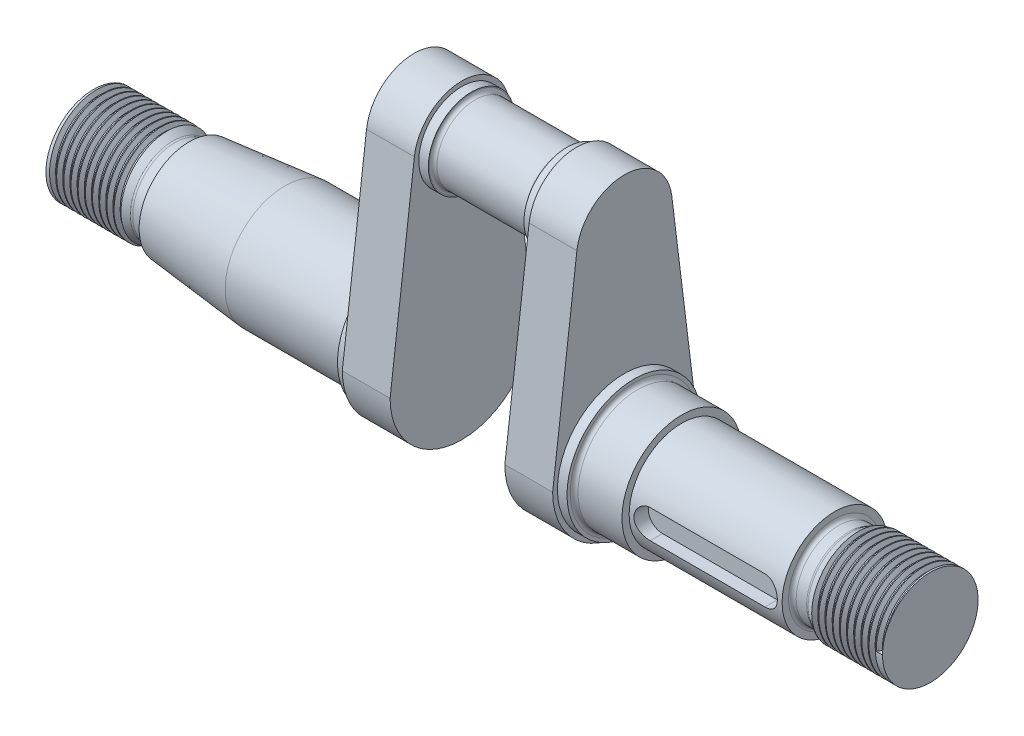
from build123d import *

# Parameters (mm, degrees)
Y_KSEKLIK_EKSTR_ZYON1_DEPTH = 15
KES_EKSTR_ZYON1_DEPTH       = 10
KES_EKSTR_ZYON2_DEPTH       = 3
DI_1_PITCH                  = 1.5
DI_2_PITCH                  = 1.5


with BuildPart() as part:
    # Çizim1 → Döndür3 (revolve)
    with BuildSketch(Plane.XY, mode=Mode.PRIVATE) as d_nd_r3_sk:
        with BuildLine():
            ThreePointArc((-2.8, 12.5), (-2.234314575, 12.734314575), (-2, 13.3))
            Line((-2, 13.3), (-2, 14))
            Line((-2, 14), (0, 14))
            Line((0, 14), (0, 0))
            Line((0, 0), (-67, 0))
            Line((-67, 0), (-67, 10))
            Line((-67, 10), (-52.2, 10))
            Line((-52.2, 10), (-50.393782217, 8.957179677))
            ThreePointArc((-50.393782217, 8.957179677), (-50.200837453, 8.877259339), (-49.993782217, 8.85))
            Line((-49.993782217, 8.85), (-47.8, 8.85))
            ThreePointArc((-47.8, 8.85), (-47.234314575, 9.084314575), (-47, 9.65))
            Line((-47, 9.65), (-47, 10.5))
            Line((-47, 10.5), (-27, 12.5))
            Line((-27, 12.5), (-2.8, 12.5))
        make_face()
    revolve(d_nd_r3_sk.sketch.rotate(Axis((127.616998905, 0, 0), (-1, 0, 0)), 90), axis=Axis((127.616998905, 0, 0), (-1, 0, 0)))

    # Çizim2 → Yükseklik-Ekstrüzyon1 (add, symmetric)
    with BuildSketch(Plane.XY):
        Polygon((0, 0), (0, 50), (10, 50), (10, -15), (0, -15), align=None)
    y_kseklik_ekstr_zyon1 = extrude(amount=Y_KSEKLIK_EKSTR_ZYON1_DEPTH, both=True)

    # Çizim3 → Kes-Ekstrüzyon1 (cut)
    with BuildSketch(Plane(origin=(10, 0, 0), x_dir=(0, 0, -1), z_dir=(1, 0, 0))):
        with BuildLine():
            Line((0, 50), (-15, 50))
            Line((-15, 50), (-15, 0))
            Line((-15, 0), (-9.925067247, 41.221900218))
            ThreePointArc((-9.925067247, 41.221900218), (-6.624990484, 47.49062755), (0, 50))
        make_face()
        with BuildLine():
            Line((15, 50), (0, 50))
            ThreePointArc((0, 50), (6.624990484, 47.49062755), (9.925067247, 41.221900218))
            Line((9.925067247, 41.221900218), (15, 0))
            Line((15, 0), (15, 50))
        make_face()
        with BuildLine():
            ThreePointArc((15, 0), (10.606601718, -10.606601718), (0, -15))
            Line((0, -15), (15, -15))
            Line((15, -15), (15, 0))
        make_face()
        with BuildLine():
            ThreePointArc((0, -15), (-10.606601718, -10.606601718), (-15, 0))
            Line((-15, 0), (-15, -15))
            Line((-15, -15), (0, -15))
        make_face()
    kes_ekstr_zyon1 = extrude(amount=-KES_EKSTR_ZYON1_DEPTH, mode=Mode.SUBTRACT)

    # Çizim6 → Döndür4 (revolve)
    with BuildSketch(Plane.XY, mode=Mode.PRIVATE) as d_nd_r4_sk:
        with BuildLine():
            Line((10, 40), (10, 49))
            Line((10, 49), (12, 49))
            Line((12, 49), (12, 48.8))
            ThreePointArc((12, 48.8), (12.234314575, 48.234314575), (12.8, 48))
            Line((12.8, 48), (31.2, 48))
            ThreePointArc((31.2, 48), (31.765685425, 48.234314575), (32, 48.8))
            Line((32, 48.8), (32, 49))
            Line((32, 49), (34, 49))
            Line((34, 49), (34, 40))
            Line((34, 40), (10, 40))
        make_face()
    revolve(d_nd_r4_sk.sketch.rotate(Axis((10, 40, 0), (1, 0, 0)), 90), axis=Axis((10, 40, 0), (1, 0, 0)))

    # Aynalama1: Yükseklik-Ekstrüzyon1 across plane
    add(y_kseklik_ekstr_zyon1.mirror(Plane(origin=(22, 0, 0), x_dir=(0, 0, 1), z_dir=(1, 0, 0))))

    # Aynalama2: Kes-Ekstrüzyon1 across plane
    add(kes_ekstr_zyon1.mirror(Plane(origin=(22, 0, 0), x_dir=(0, 0, 1), z_dir=(1, 0, 0))), mode=Mode.SUBTRACT)

    # Çizim9 → Döndür5 (revolve)
    with BuildSketch(Plane.XY, mode=Mode.PRIVATE) as d_nd_r5_sk:
        with BuildLine():
            Line((44, 0), (44, 14))
            Line((44, 14), (46, 14))
            Line((46, 14), (46, 13.3))
            ThreePointArc((46, 13.3), (46.234314575, 12.734314575), (46.8, 12.5))
            Line((46.8, 12.5), (56, 12.5))
            Line((56, 12.5), (56, 11))
            Line((56, 11), (88, 11))
            Line((88, 11), (88, 0))
            Line((88, 0), (44, 0))
        make_face()
    revolve(d_nd_r5_sk.sketch.rotate(Axis((44, 0, 0), (1, 0, 0)), 90), axis=Axis((44, 0, 0), (1, 0, 0)))

    # Çizim10 → Döndür6 (revolve)
    with BuildSketch(Plane.XY, mode=Mode.PRIVATE) as d_nd_r6_sk:
        with BuildLine():
            Line((88, 0), (108, 0))
            Line((108, 0), (108, 10))
            Line((108, 10), (93.2, 10))
            Line((93.2, 10), (91.393782217, 8.957179677))
            ThreePointArc((91.393782217, 8.957179677), (91.200837453, 8.877259339), (90.993782217, 8.85))
            Line((90.993782217, 8.85), (88.8, 8.85))
            ThreePointArc((88.8, 8.85), (88.234314575, 9.084314575), (88, 9.65))
            Line((88, 9.65), (88, 0))
        make_face()
    revolve(d_nd_r6_sk.sketch.rotate(Axis((44, 0, 0), (1, 0, 0)), 90), axis=Axis((44, 0, 0), (1, 0, 0)))

    # Çizim11 → Kes-Ekstrüzyon2 (cut)
    with BuildSketch(Plane.XY.offset(11)):
        with BuildLine():
            Line((84, -3), (60, -3))
            ThreePointArc((60, -3), (57, 0), (60, 3))
            Line((60, 3), (84, 3))
            ThreePointArc((84, 3), (87, 0), (84, -3))
        make_face()
    kes_ekstr_zyon2 = extrude(amount=-KES_EKSTR_ZYON2_DEPTH, mode=Mode.SUBTRACT)

    # Aynalama3: Kes-Ekstrüzyon2 across plane
    add(kes_ekstr_zyon2.mirror(Plane.XY), mode=Mode.SUBTRACT)

    # Diş1: the profile of Diş Profili1 profile screwed along a right-hand helix of 9.866667 turns, 8 arcs to a turn; built about Z, then put on its axis
    di_1_z = Axis((0, 0, 0), (0, 0, 1))
    di_1_corners = [(10.0003, 0, -0.000173205), (10.0003, 0, 1.312673201), (9.188101187, 0, 0.843749998), (9.188101187, 0, 0.468749998)]
    with BuildLine(mode=Mode.PRIVATE) as di_1_profile:
        Line(di_1_corners[0], di_1_corners[1])
        Line(di_1_corners[1], di_1_corners[2])
        Line(di_1_corners[2], di_1_corners[3])
        Line(di_1_corners[3], di_1_corners[0])
    di_1_cap = Face(di_1_profile.wire())
    di_1_turn_angles = [0, 22.5, 45, 67.5, 90, 112.5, 135, 157.5, 180, 202.5, 225, 247.5, 270, 292.5, 315, 337.5, 360]
    di_1_turn_weights = [1, 0.9238795325112867, 1, 0.9238795325112867, 1, 0.9238795325112867, 1, 0.9238795325112867, 1, 0.9238795325112867, 1, 0.9238795325112867, 1, 0.9238795325112867, 1, 0.9238795325112867, 1]
    di_1_turn_rails = [Edge.make_bspline([Vector(p[0], p[1], 0).rotate(di_1_z, di_1_turn_angles[k]) / di_1_turn_weights[k] + Vector(0, 0, p[2] + DI_1_PITCH * di_1_turn_angles[k] / 360) for k in range(17)], [0, 0, 0, 1, 1, 2, 2, 3, 3, 4, 4, 5, 5, 6, 6, 7, 7, 8, 8, 8], 2, di_1_turn_weights) for p in di_1_corners]
    di_1_turn_sides = [Face.make_surface_from_curves(di_1_turn_rails[p[0]], di_1_turn_rails[p[1]]) for p in [(0, 1), (1, 2), (2, 3), (3, 0)]]
    di_1_last_angles = [3240, 3262.5, 3285, 3307.5, 3330, 3352.5, 3375, 3397.5, 3420, 3442.5, 3465, 3487.5, 3510, 3531, 3552]
    di_1_last_weights = [1, 0.9238795325112867, 1, 0.9238795325112867, 1, 0.9238795325112867, 1, 0.9238795325112867, 1, 0.9238795325112867, 1, 0.9238795325112867, 1, 0.9335804264971975, 1]
    di_1_last_rails = [Edge.make_bspline([Vector(p[0], p[1], 0).rotate(di_1_z, di_1_last_angles[k]) / di_1_last_weights[k] + Vector(0, 0, p[2] + DI_1_PITCH * di_1_last_angles[k] / 360) for k in range(15)], [0, 0, 0, 1, 1, 2, 2, 3, 3, 4, 4, 5, 5, 6, 6, 7, 7, 7], 2, di_1_last_weights) for p in di_1_corners]
    di_1_last_sides = [Face.make_surface_from_curves(di_1_last_rails[p[0]], di_1_last_rails[p[1]]) for p in [(0, 1), (1, 2), (2, 3), (3, 0)]]
    di_1 = Plane(origin=(-67, 0, 0), x_dir=(0, 0, -1), z_dir=(1, 0, 0)) * Solid(Shell([*[p.moved(Location((0, 0, DI_1_PITCH * i))) for i in range(9) for p in di_1_turn_sides], *di_1_last_sides, di_1_cap, di_1_cap.rotate(di_1_z, 3552).moved(Location((0, 0, DI_1_PITCH * 3552 / 360)))]))
    add(di_1, mode=Mode.SUBTRACT)

    # Diş2: the profile of Diş Profili2 profile screwed along a right-hand helix of 9.866667 turns, 8 arcs to a turn; built about Z, then put on its axis
    di_2_z = Axis((0, 0, 0), (0, 0, 1))
    di_2_corners = [(10.0003, 0, -0.000173205), (10.0003, 0, 1.312673201), (9.188101187, 0, 0.843749998), (9.188101187, 0, 0.468749998)]
    with BuildLine(mode=Mode.PRIVATE) as di_2_profile:
        Line(di_2_corners[0], di_2_corners[1])
        Line(di_2_corners[1], di_2_corners[2])
        Line(di_2_corners[2], di_2_corners[3])
        Line(di_2_corners[3], di_2_corners[0])
    di_2_cap = Face(di_2_profile.wire())
    di_2_turn_angles = [0, 22.5, 45, 67.5, 90, 112.5, 135, 157.5, 180, 202.5, 225, 247.5, 270, 292.5, 315, 337.5, 360]
    di_2_turn_weights = [1, 0.9238795325112867, 1, 0.9238795325112867, 1, 0.9238795325112867, 1, 0.9238795325112867, 1, 0.9238795325112867, 1, 0.9238795325112867, 1, 0.9238795325112867, 1, 0.9238795325112867, 1]
    di_2_turn_rails = [Edge.make_bspline([Vector(p[0], p[1], 0).rotate(di_2_z, di_2_turn_angles[k]) / di_2_turn_weights[k] + Vector(0, 0, p[2] + DI_2_PITCH * di_2_turn_angles[k] / 360) for k in range(17)], [0, 0, 0, 1, 1, 2, 2, 3, 3, 4, 4, 5, 5, 6, 6, 7, 7, 8, 8, 8], 2, di_2_turn_weights) for p in di_2_corners]
    di_2_turn_sides = [Face.make_surface_from_curves(di_2_turn_rails[p[0]], di_2_turn_rails[p[1]]) for p in [(0, 1), (1, 2), (2, 3), (3, 0)]]
    di_2_last_angles = [3240, 3262.5, 3285, 3307.5, 3330, 3352.5, 3375, 3397.5, 3420, 3442.5, 3465, 3487.5, 3510, 3531, 3552]
    di_2_last_weights = [1, 0.9238795325112867, 1, 0.9238795325112867, 1, 0.9238795325112867, 1, 0.9238795325112867, 1, 0.9238795325112867, 1, 0.9238795325112867, 1, 0.9335804264972088, 1]
    di_2_last_rails = [Edge.make_bspline([Vector(p[0], p[1], 0).rotate(di_2_z, di_2_last_angles[k]) / di_2_last_weights[k] + Vector(0, 0, p[2] + DI_2_PITCH * di_2_last_angles[k] / 360) for k in range(15)], [0, 0, 0, 1, 1, 2, 2, 3, 3, 4, 4, 5, 5, 6, 6, 7, 7, 7], 2, di_2_last_weights) for p in di_2_corners]
    di_2_last_sides = [Face.make_surface_from_curves(di_2_last_rails[p[0]], di_2_last_rails[p[1]]) for p in [(0, 1), (1, 2), (2, 3), (3, 0)]]
    di_2 = Plane(origin=(108, 0, 0), x_dir=(0, 0, 1), z_dir=(-1, 0, 0)) * Solid(Shell([*[p.moved(Location((0, 0, DI_2_PITCH * i))) for i in range(9) for p in di_2_turn_sides], *di_2_last_sides, di_2_cap, di_2_cap.rotate(di_2_z, 3552).moved(Location((0, 0, DI_2_PITCH * 3552 / 360)))]))
    add(di_2, mode=Mode.SUBTRACT)


solid = part.part
